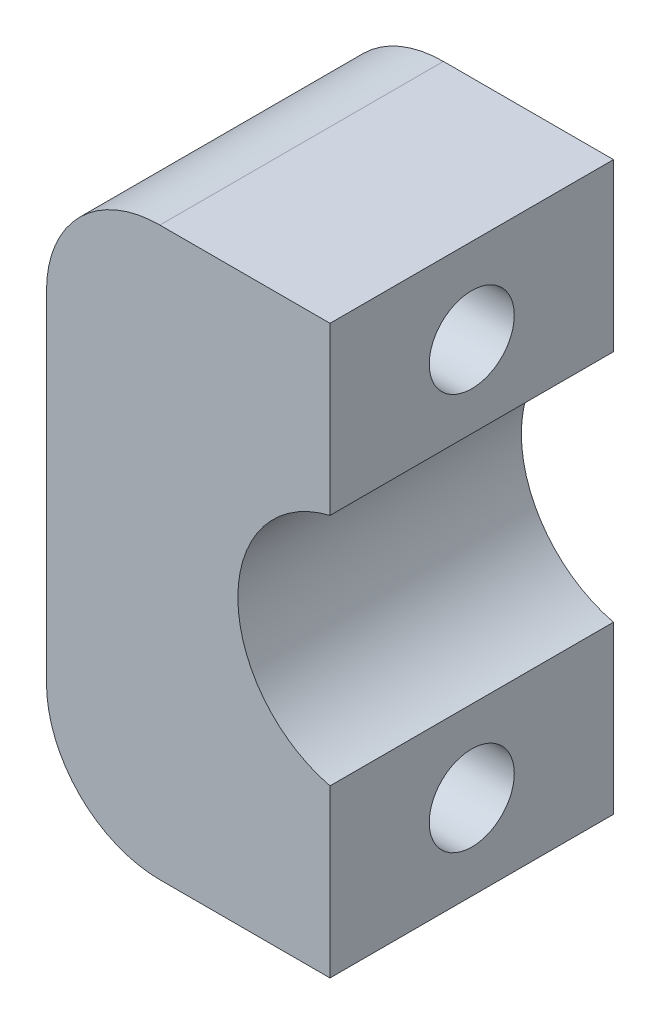
from build123d import *

# Parameters (mm, degrees)
SKETCH1_W           = 10
SKETCH1_H           = 10
BOSS_EXTRUDE1_DEPTH = 20
SKETCH2_R           = 4.25
CUT_EXTRUDE1_DEPTH  = 23.912878475
SKETCH3_R           = 1.5
CUT_EXTRUDE2_DEPTH  = 23.912878475
FILLET1_R           = 4


with BuildPart() as part:
    # Sketch1 → Boss-Extrude1 (new body)
    with BuildSketch(Plane(origin=(0, 0, 0), x_dir=(1, 0, 0), z_dir=(0, 1, 0))):
        Rectangle(SKETCH1_W, SKETCH1_H)
    extrude(amount=BOSS_EXTRUDE1_DEPTH)

    # Sketch2 → Cut-Extrude1 (cut, through all)
    with BuildSketch(Plane.XY.offset(5)):
        with Locations((6, 10)):
            Circle(SKETCH2_R)
    extrude(amount=-CUT_EXTRUDE1_DEPTH, mode=Mode.SUBTRACT)

    # Sketch3 → Cut-Extrude2 (cut, through all)
    with BuildSketch(Plane(origin=(5, 0, 0), x_dir=(0, 0, -1), z_dir=(1, 0, 0))):
        with Locations((0, 3)):
            Circle(SKETCH3_R)
        with Locations((0, 17)):
            Circle(SKETCH3_R)
    extrude(amount=-CUT_EXTRUDE2_DEPTH, mode=Mode.SUBTRACT)

    # Fillet1
    # the kernel refuses this fillet: 4 mm, written as the material it takes off along each edge
    with BuildSketch(Plane(origin=(-5, 20, 15), x_dir=(0, -1, 0), z_dir=(0, 0, -1)), Plane(origin=(-5, 0, 15), x_dir=(1, 0, 0), z_dir=(0, 0, -1))) as fillet1_piece_1:
        with BuildLine():
            CenterArc((FILLET1_R, -FILLET1_R), FILLET1_R, 90, 90)
            Line((0, -FILLET1_R), (0, 0))
            Line((0, 0), (FILLET1_R, 0))
        make_face()
    extrude(amount=30, mode=Mode.SUBTRACT)


solid = part.part
